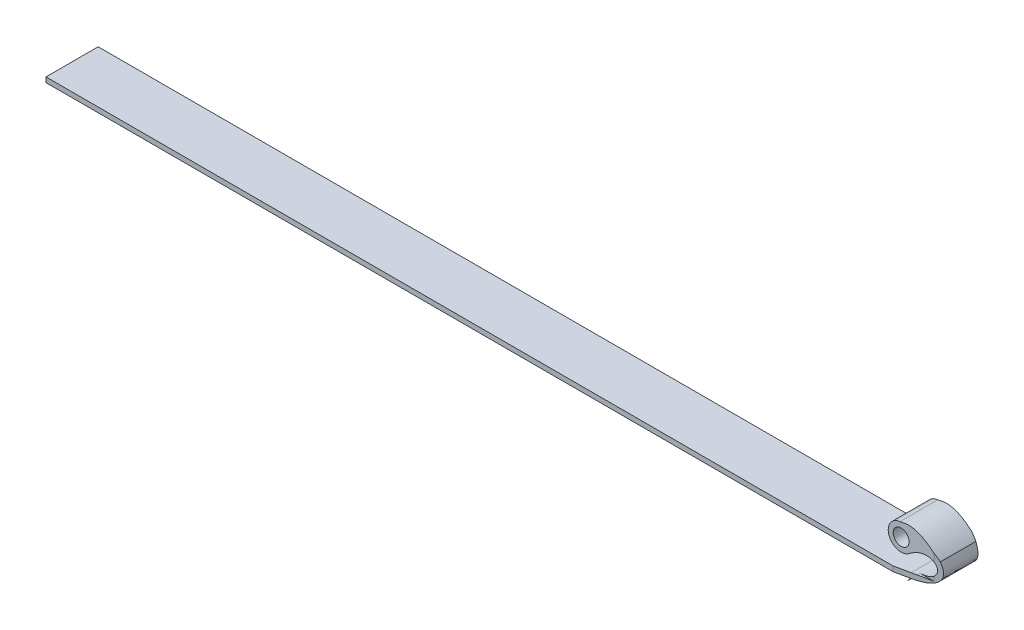
from build123d import *

# Parameters (mm, degrees)
BOSS_EXTRUDE1_DEPTH     = 1.524
BOSS_EXTRUDE2_START     = -15.875
BOSS_EXTRUDE2_OUTLINE_R = 2.413
BOSS_EXTRUDE2_DEPTH     = 15.875
CUT_EXTRUDE1_DEPTH      = 162.377710637
CUT_EXTRUDE2_DEPTH      = 162.267022773


# Read off the part's stored shape, not the designer's step: Boss-Extrude2
with BuildPart() as part:
    # Sketch1 → Boss-Extrude1 (new body)
    with BuildSketch(Plane(origin=(0, 0, 0), x_dir=(1, 0, 0), z_dir=(0, 1, 0))):
        Polygon((-101.6, -7.9375), (-160.698602846, -7.9375), (-160.698602846, 7.9375), (-101.6, 7.9375), (101.6, 7.9375), (101.6, -7.9375), align=None)
    extrude(amount=BOSS_EXTRUDE1_DEPTH)

    # Boss-Extrude2 outline → Boss-Extrude2 (add)
    with BuildSketch(Plane.XY.offset(7.9375).offset(BOSS_EXTRUDE2_START)):
        with BuildLine():
            add(Edge.make_bspline(
                [(107.228546138, 6.692607406), (106.366027923, 7.18125968), (105.140033894, 7.42790314), (103.583408394, 7.287922485), (101.756786703, 6.577932625), (99.786331846, 5.041015057)],
                knots=[0, 0, 0, 0, 0, 0, 1, 1, 1, 1, 1, 1], degree=5))
            ThreePointArc((107.228546138, 6.692607406), (108.258782429, 4.761783473), (107.30453503, 2.792296286))
            add(Edge.make_bspline(
                [(101.6, 1.524), (103.258114517, 1.448306251), (104.638933259, 1.583946831), (105.766741539, 1.881154947), (106.652889556, 2.297992507), (107.30453503, 2.792296286)],
                knots=[0, 0, 0, 0, 0, 0, 1, 1, 1, 1, 1, 1], degree=5))
            Line((101.6, 1.524), (101.6, 0))
            add(Edge.make_bspline(
                [(101.6, 0), (104.748480566, -0.003746591), (109.050367624, 0.259943099), (110.73800353, 3.235869603), (109.946934459, 5.044027479), (108.94689031, 7.25796652)],
                knots=[0, 0, 0, 0, 0, 0, 1, 1, 1, 1, 1, 1], degree=5))
            add(Edge.make_bspline(
                [(108.94689031, 7.25796652), (106.455515071, 10.263008134), (101.235622898, 14.016404122), (98.534099755, 12.238404022), (96.99562172, 12.065011937)],
                knots=[0, 0, 0, 0, 0, 1, 1, 1, 1, 1], degree=4))
            ThreePointArc((96.99562172, 12.065011937), (93.706192437, 6.691697876), (99.786331846, 5.041015057))
        make_face()
        with Locations((97.364988112, 8.145377073)):
            Circle(BOSS_EXTRUDE2_OUTLINE_R, mode=Mode.SUBTRACT)
    extrude(amount=BOSS_EXTRUDE2_DEPTH)

    # Sketch6 → Cut-Extrude1 (cut, through all)
    with BuildSketch(Plane.XZ):
        Polygon((109.757786654, 7.9375), (101.6, 7.9375), (101.6, 6.972022749), (109.757786654, 5.238031667), align=None)
        Polygon((109.757786654, -5.238031667), (101.6, -6.972022749), (101.6, -7.9375), (109.757786654, -7.9375), align=None)
        Polygon((101.6, 7.9375), (97.057786654, 7.9375), (101.6, 6.972022749), align=None)
        Polygon((101.6, -7.9375), (101.6, -6.972022749), (97.057786654, -7.9375), align=None)
    extrude(amount=-CUT_EXTRUDE1_DEPTH, mode=Mode.SUBTRACT)

    # Sketch7 → Cut-Extrude2 (cut, through all)
    with BuildSketch(Plane(origin=(0, 1.524, 0), x_dir=(1, 0, 0), z_dir=(0, 1, 0))):
        Polygon((101.6, 5.759486397), (107.30453503, 5.759486397), (107.30453503, 11.866720982), (85.552872932, 11.866720982), (85.552872932, 7.9375), (97.057786654, 7.9375), (101.6, 6.972022749), align=None)
        Polygon((85.552872932, 5.759486397), (101.6, 5.759486397), (101.6, 6.972022749), (97.057786654, 7.9375), (85.552872932, 7.9375), align=None)
        Polygon((101.6, -6.972022749), (101.6, -5.759486397), (85.552872932, -5.759486397), (85.552872932, -7.9375), (97.057786654, -7.9375), align=None)
        Polygon((107.30453503, -7.9375), (107.30453503, -5.759486397), (101.6, -5.759486397), (101.6, -6.972022749), (97.057786654, -7.9375), align=None)
    extrude(amount=CUT_EXTRUDE2_DEPTH, mode=Mode.SUBTRACT)


solid = part.part
